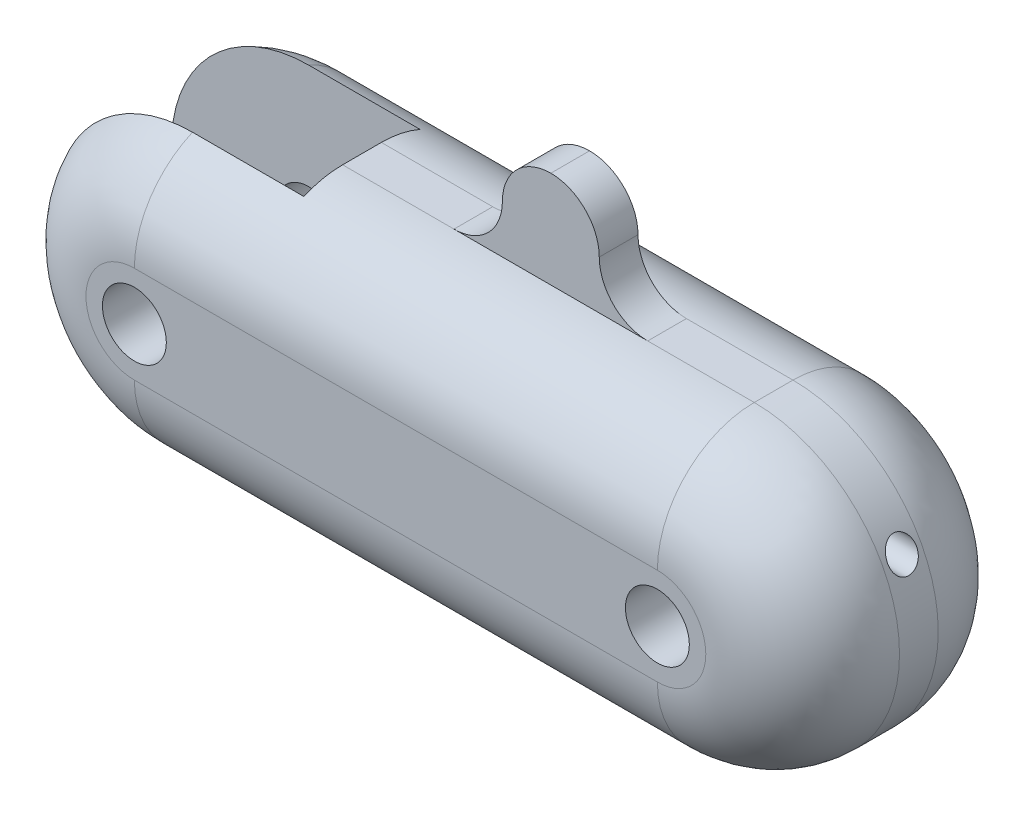
from build123d import *

# Parameters (mm, degrees)
BOSS_EXTRUDE1_DEPTH = 12
FILLET1_R           = 5
SKETCH5_W           = 13.25
SKETCH5_H           = 6
CUT_EXTRUDE3_DEPTH  = 35.785054262
SKETCH6_W           = 5
SKETCH6_H           = 2
BOSS_EXTRUDE2_DEPTH = 5
FILLET2_R           = 2.5
FILLET3_R           = 2.5
SKETCH3_R           = 1.65
CUT_EXTRUDE4_DEPTH  = 29.460498984
SKETCH8_R           = 0.75
CUT_EXTRUDE7_DEPTH  = 46.805137399
SKETCH9_R           = 0.75
CUT_EXTRUDE9_DEPTH  = 15.765865025


with BuildPart() as part:
    # Sketch2 → Boss-Extrude1 (new body)
    with BuildSketch(Plane.XY):
        with BuildLine():
            Line((-13.5, 0), (13.5, 0))
            ThreePointArc((13.5, 0), (21, -7.5), (13.5, -15))
            Line((13.5, -15), (-13.5, -15))
            ThreePointArc((-13.5, -15), (-21, -7.5), (-13.5, 0))
        make_face()
    extrude(amount=BOSS_EXTRUDE1_DEPTH)

    # Fillet1
    fillet1_edges = [part.edges().sort_by_distance(p)[0] for p in [
        (-21, -7.5, 12),
        (0, -15, 12),
        (21, -7.5, 12),
        (0, -15, 0),
        (-21, -7.5, 0),
        (0, 0, 0),
        (21, -7.5, 0),
        (0, 0, 12),
    ]]
    fillet(fillet1_edges, radius=FILLET1_R)

    # Sketch5 → Cut-Extrude3 (cut, through all)
    with BuildSketch(Plane(origin=(0, -25, 0), x_dir=(-1, 0, 0), z_dir=(0, -1, 0))):
        with Locations((14.375, -6)):
            Rectangle(SKETCH5_W, SKETCH5_H)
    extrude(amount=-CUT_EXTRUDE3_DEPTH, mode=Mode.SUBTRACT)

    # Sketch6 → Boss-Extrude2 (add)
    with BuildSketch(Plane(origin=(0, 0, 0), x_dir=(1, 0, 0), z_dir=(0, 1, 0))):
        with Locations((3, -6)):
            Rectangle(SKETCH6_W, SKETCH6_H)
    extrude(amount=BOSS_EXTRUDE2_DEPTH)

    # Fillet2
    fillet2_edges = [part.edges().sort_by_distance(p)[0] for p in [
        (5.5, 5, 6),
        (0.5, 5, 6),
    ]]
    fillet(fillet2_edges, radius=FILLET2_R - 0.0001)  # a hair under: the kernel refuses the full size

    # Fillet3
    fillet3_edges = [part.edges().sort_by_distance(p)[0] for p in [
        (0.5, 0, 6),
        (5.5, 0, 6),
    ]]
    fillet(fillet3_edges, radius=FILLET3_R)

    # Sketch3 → Cut-Extrude4 (cut, through all)
    with BuildSketch(Plane.XY.offset(12)):
        with Locations((-13.5, -7.5)):
            Circle(SKETCH3_R)
        with Locations((13.5, -7.5)):
            Circle(SKETCH3_R)
    extrude(amount=-CUT_EXTRUDE4_DEPTH, mode=Mode.SUBTRACT)

    # Sketch8 → Cut-Extrude7 (cut, through all)
    with BuildSketch(Plane(origin=(21, 0, 0), x_dir=(0, 0, -1), z_dir=(1, 0, 0))):
        with Locations((-6, -4)):
            Circle(SKETCH8_R)
    extrude(amount=-CUT_EXTRUDE7_DEPTH, mode=Mode.SUBTRACT)

    # Sketch9 → Cut-Extrude9 (cut, along a direction that is not the sketch's normal)
    with BuildSketch(Plane.ZY.offset(7.75)):
        with Locations((6, -11)):
            Circle(SKETCH9_R)
    extrude(amount=-CUT_EXTRUDE9_DEPTH, dir=(-0.9672796243913314, 0.25371268836493915, 0), mode=Mode.SUBTRACT)


solid = part.part
